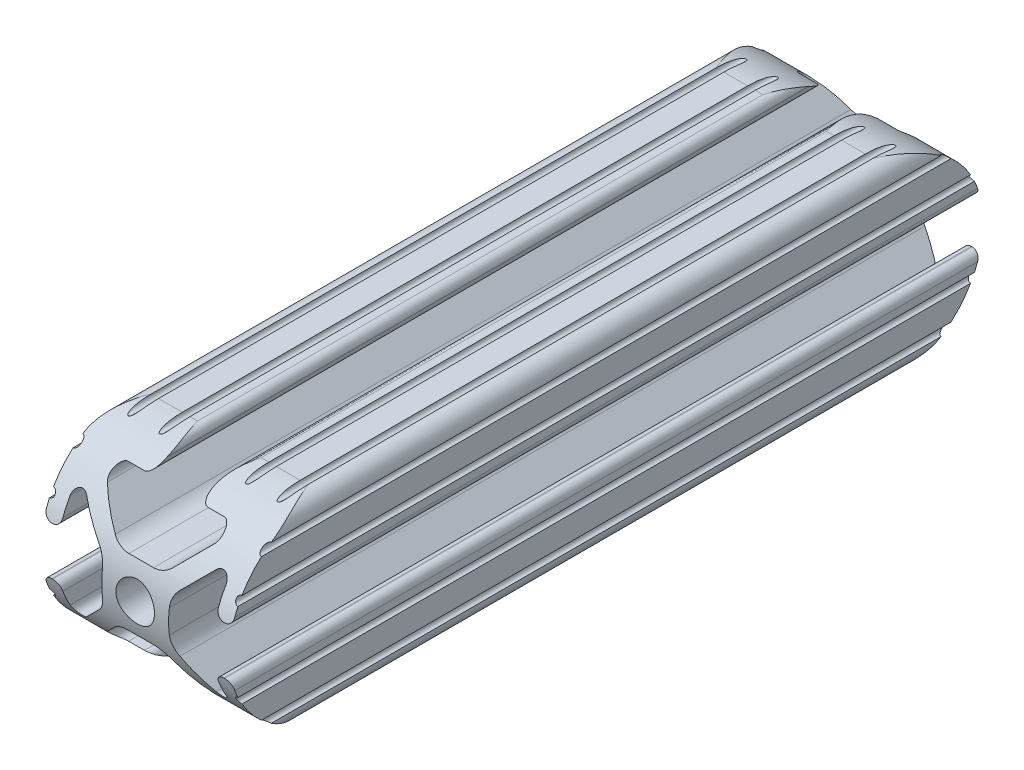
from build123d import *
from build123d.topology import SkipClean

# Parameters (mm, degrees)
SKETCH1_R           = 2.6035
BOSS_EXTRUDE1_DEPTH = 50.8
CUT_EXTRUDE1_DEPTH  = 59.198711326


with BuildPart() as part:
    # Sketch1 → Boss-Extrude1 (new, symmetric)
    with BuildSketch(Plane.XY):
        with BuildLine():
            Line((-7.179650497, -8.645192506), (-3.952270251, -5.423690499))
            ThreePointArc((-3.952270251, -5.423690499), (-2.922936451, -4.736929036), (-1.709253557, -4.4958))
            Line((-1.709253557, -4.4958), (1.709253557, -4.4958))
            ThreePointArc((1.709253557, -4.4958), (2.922936451, -4.736929036), (3.952270251, -5.423690499))
            Line((3.952270251, -5.423690499), (7.179650497, -8.645192506))
            ThreePointArc((7.179650497, -8.645192506), (7.41473083, -9.822813117), (6.416408329, -10.4902))
            Line((6.416408329, -10.4902), (4.287512407, -10.4902))
            ThreePointArc((4.287512407, -10.4902), (3.54574862, -10.79744862), (3.2385, -11.539212407))
            Line((3.2385, -11.539212407), (3.2385, -11.650987593))
            ThreePointArc((3.2385, -11.650987593), (3.54574862, -12.39275138), (4.287512407, -12.7))
            Line((4.287512407, -12.7), (5.317126718, -12.7))
            ThreePointArc((5.317126718, -12.7), (5.825126718, -12.192), (6.333126718, -12.7))
            Line((6.333126718, -12.7), (9.550443118, -12.7))
            ThreePointArc((9.550443118, -12.7), (10.058366869, -12.192000006), (10.566443095, -12.699847501))
            ThreePointArc((10.566443095, -12.699847501), (12.082537762, -12.08250727), (12.699846982, -10.566399977))
            ThreePointArc((12.699846982, -10.566399977), (12.192000006, -10.058323491), (12.7, -9.5504))
            Line((12.7, -9.5504), (12.7, -6.3330836))
            ThreePointArc((12.7, -6.3330836), (12.192, -5.8250836), (12.7, -5.3170836))
            Line((12.7, -5.3170836), (12.7, -4.287469289))
            ThreePointArc((12.7, -4.287469289), (12.39275138, -3.545705502), (11.650987593, -3.238456882))
            Line((11.650987593, -3.238456882), (11.539212407, -3.238456882))
            ThreePointArc((11.539212407, -3.238456882), (10.79744862, -3.545705502), (10.4902, -4.287469289))
            Line((10.4902, -4.287469289), (10.4902, -6.402089023))
            ThreePointArc((10.4902, -6.402089023), (9.856505071, -7.351067942), (8.737131347, -7.129408934))
            Line((8.737131347, -7.129408934), (5.441005833, -3.840816462))
            ThreePointArc((5.441005833, -3.840816462), (4.750877967, -2.809883091), (4.5085, -1.593185507))
            Line((4.5085, -1.593185507), (4.5085, 1.593185507))
            ThreePointArc((4.5085, 1.593185507), (4.750877967, 2.809883091), (5.441005833, 3.840816462))
            Line((5.441005833, 3.840816462), (8.737131347, 7.129408934))
            ThreePointArc((8.737131347, 7.129408934), (9.856505071, 7.351067942), (10.4902, 6.402089023))
            Line((10.4902, 6.402089023), (10.4902, 4.287469289))
            ThreePointArc((10.4902, 4.287469289), (10.79744862, 3.545705502), (11.539212407, 3.238456882))
            Line((11.539212407, 3.238456882), (11.650987593, 3.238456882))
            ThreePointArc((11.650987593, 3.238456882), (12.39275138, 3.545705502), (12.7, 4.287469289))
            Line((12.7, 4.287469289), (12.7, 5.3170836))
            ThreePointArc((12.7, 5.3170836), (12.192, 5.8250836), (12.7, 6.3330836))
            Line((12.7, 6.3330836), (12.7, 9.5504))
            ThreePointArc((12.7, 9.5504), (12.192000006, 10.058323491), (12.699846982, 10.566399977))
            ThreePointArc((12.699846982, 10.566399977), (12.082537762, 12.08250727), (10.566443095, 12.699847501))
            ThreePointArc((10.566443095, 12.699847501), (10.058366869, 12.192000006), (9.550443118, 12.7))
            Line((9.550443118, 12.7), (6.333126718, 12.7))
            ThreePointArc((6.333126718, 12.7), (5.825126718, 12.192), (5.317126718, 12.7))
            Line((5.317126718, 12.7), (4.287512407, 12.7))
            ThreePointArc((4.287512407, 12.7), (3.54574862, 12.39275138), (3.2385, 11.650987593))
            Line((3.2385, 11.650987593), (3.2385, 11.539212407))
            ThreePointArc((3.2385, 11.539212407), (3.54574862, 10.79744862), (4.287512407, 10.4902))
            Line((4.287512407, 10.4902), (6.476788598, 10.4902))
            ThreePointArc((6.476788598, 10.4902), (7.432222385, 9.85140422), (7.207036008, 8.724370562))
            Line((7.207036008, 8.724370562), (3.898272566, 5.423169045))
            ThreePointArc((3.898272566, 5.423169045), (2.869120213, 4.736787962), (1.655778399, 4.4958))
            Line((1.655778399, 4.4958), (-1.655778399, 4.4958))
            ThreePointArc((-1.655778399, 4.4958), (-2.869120213, 4.736787962), (-3.898272566, 5.423169045))
            Line((-3.898272566, 5.423169045), (-7.207036008, 8.724370562))
            ThreePointArc((-7.207036008, 8.724370562), (-7.432222385, 9.85140422), (-6.476788598, 10.4902))
            Line((-6.476788598, 10.4902), (-4.287512407, 10.4902))
            ThreePointArc((-4.287512407, 10.4902), (-3.54574862, 10.79744862), (-3.2385, 11.539212407))
            Line((-3.2385, 11.539212407), (-3.2385, 11.650987593))
            ThreePointArc((-3.2385, 11.650987593), (-3.54574862, 12.39275138), (-4.287512407, 12.7))
            Line((-4.287512407, 12.7), (-5.317126718, 12.7))
            ThreePointArc((-5.317126718, 12.7), (-5.825126718, 12.192), (-6.333126718, 12.7))
            Line((-6.333126718, 12.7), (-9.550443118, 12.7))
            ThreePointArc((-9.550443118, 12.7), (-10.058366869, 12.192000006), (-10.566443095, 12.699847501))
            ThreePointArc((-10.566443095, 12.699847501), (-12.082537762, 12.08250727), (-12.699846982, 10.566399977))
            ThreePointArc((-12.699846982, 10.566399977), (-12.192000006, 10.058323491), (-12.7, 9.5504))
            Line((-12.7, 9.5504), (-12.7, 6.3330836))
            ThreePointArc((-12.7, 6.3330836), (-12.192, 5.8250836), (-12.7, 5.3170836))
            Line((-12.7, 5.3170836), (-12.7, 4.287469289))
            ThreePointArc((-12.7, 4.287469289), (-12.39275138, 3.545705502), (-11.650987593, 3.238456882))
            Line((-11.650987593, 3.238456882), (-11.539212407, 3.238456882))
            ThreePointArc((-11.539212407, 3.238456882), (-10.79744862, 3.545705502), (-10.4902, 4.287469289))
            Line((-10.4902, 4.287469289), (-10.4902, 6.402089023))
            ThreePointArc((-10.4902, 6.402089023), (-9.856505071, 7.351067942), (-8.737131347, 7.129408934))
            Line((-8.737131347, 7.129408934), (-5.441005833, 3.840816462))
            ThreePointArc((-5.441005833, 3.840816462), (-4.750877967, 2.809883091), (-4.5085, 1.593185507))
            Line((-4.5085, 1.593185507), (-4.5085, -1.593185507))
            ThreePointArc((-4.5085, -1.593185507), (-4.750877967, -2.809883091), (-5.441005833, -3.840816462))
            Line((-5.441005833, -3.840816462), (-8.737131347, -7.129408934))
            ThreePointArc((-8.737131347, -7.129408934), (-9.856505071, -7.351067942), (-10.4902, -6.402089023))
            Line((-10.4902, -6.402089023), (-10.4902, -4.287469289))
            ThreePointArc((-10.4902, -4.287469289), (-10.79744862, -3.545705502), (-11.539212407, -3.238456882))
            Line((-11.539212407, -3.238456882), (-11.650987593, -3.238456882))
            ThreePointArc((-11.650987593, -3.238456882), (-12.39275138, -3.545705502), (-12.7, -4.287469289))
            Line((-12.7, -4.287469289), (-12.7, -5.3170836))
            ThreePointArc((-12.7, -5.3170836), (-12.192, -5.8250836), (-12.7, -6.3330836))
            Line((-12.7, -6.3330836), (-12.7, -9.5504))
            ThreePointArc((-12.7, -9.5504), (-12.192000006, -10.058323491), (-12.699846982, -10.566399977))
            ThreePointArc((-12.699846982, -10.566399977), (-12.082537762, -12.08250727), (-10.566443095, -12.699847501))
            ThreePointArc((-10.566443095, -12.699847501), (-10.058366869, -12.192000006), (-9.550443118, -12.7))
            Line((-9.550443118, -12.7), (-6.333126718, -12.7))
            ThreePointArc((-6.333126718, -12.7), (-5.825126718, -12.192), (-5.317126718, -12.7))
            Line((-5.317126718, -12.7), (-4.287512407, -12.7))
            ThreePointArc((-4.287512407, -12.7), (-3.54574862, -12.39275138), (-3.2385, -11.650987593))
            Line((-3.2385, -11.650987593), (-3.2385, -11.539212407))
            ThreePointArc((-3.2385, -11.539212407), (-3.54574862, -10.79744862), (-4.287512407, -10.4902))
            Line((-4.287512407, -10.4902), (-6.416408329, -10.4902))
            ThreePointArc((-6.416408329, -10.4902), (-7.41473083, -9.822813117), (-7.179650497, -8.645192506))
        make_face()
        Circle(SKETCH1_R, mode=Mode.SUBTRACT)
    extrude(amount=BOSS_EXTRUDE1_DEPTH, both=True)

    # Sketch2 → Cut-Extrude1 (cut, through all)
    with SkipClean():  # the faces are left unmerged after this step: merging them gives an invalid solid
        with BuildSketch(Plane(origin=(12.7, 0, 0), x_dir=(0, 0, -1), z_dir=(1, 0, 0))):
            with BuildLine():
                Line((38.1, -12.7), (50.8, -12.7))
                Line((50.8, -12.7), (50.8, 0))
                ThreePointArc((50.8, 0), (47.080256121, -8.980256121), (38.1, -12.7))
            make_face()
            with BuildLine():
                Line((-50.8, -12.7), (-38.09999997, -12.7))
                ThreePointArc((-38.09999997, -12.7), (-47.08025611, -8.980256132), (-50.8, 0))
                Line((-50.8, 0), (-50.8, -12.7))
            make_face()
            with BuildLine():
                ThreePointArc((38.1, 12.7), (47.080256121, 8.980256121), (50.8, 0))
                Line((50.8, 0), (50.8, 12.7))
                Line((50.8, 12.7), (38.1, 12.7))
            make_face()
            with BuildLine():
                Line((-50.8, 12.7), (-50.8, 0))
                ThreePointArc((-50.8, 0), (-47.080256121, 8.980256121), (-38.1, 12.7))
                Line((-38.1, 12.7), (-50.8, 12.7))
            make_face()
        extrude(amount=-CUT_EXTRUDE1_DEPTH, mode=Mode.SUBTRACT)


solid = part.part
